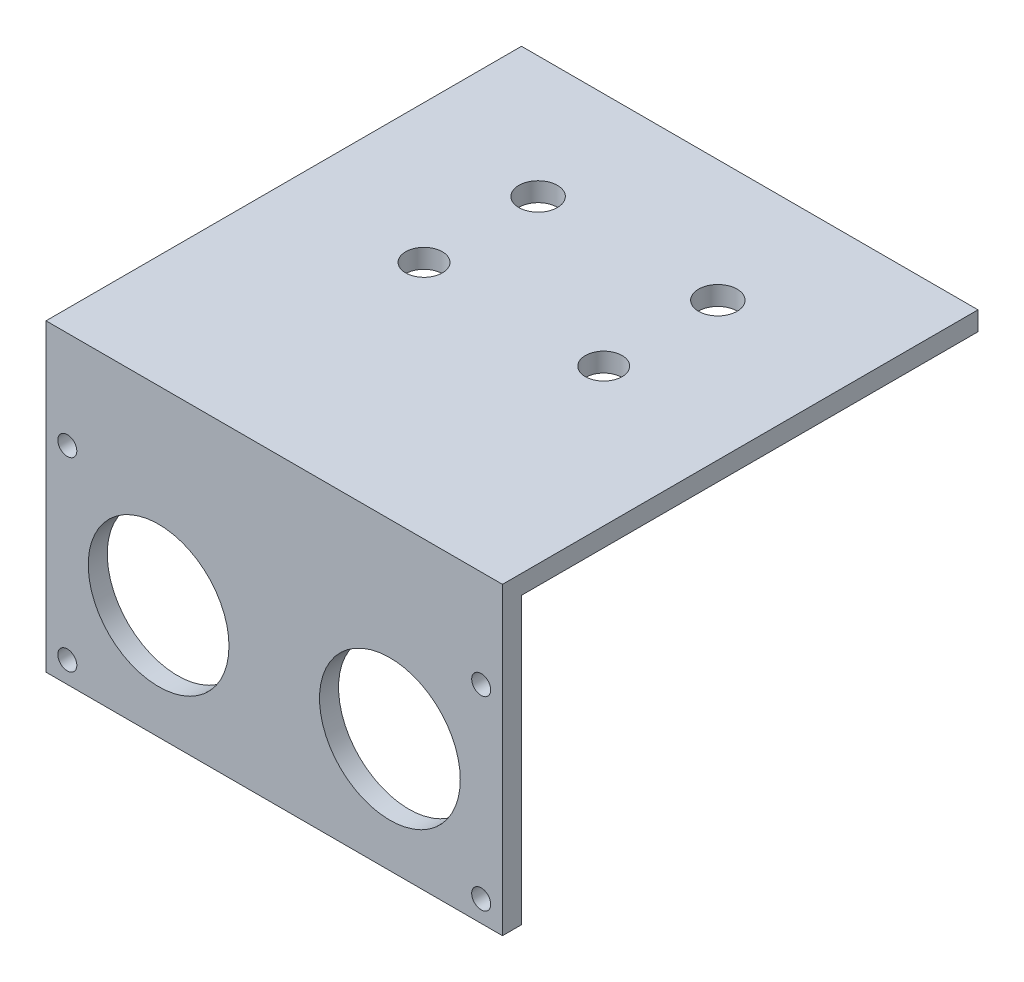
from build123d import *

# Parameters (mm, degrees)
SKETCH1_W           = 152.4
SKETCH1_H           = 101.6
SKETCH1_R           = 3.175
SKETCH1_R_2         = 23.495
BOSS_EXTRUDE2_DEPTH = 6.35
SKETCH2_W           = 152.4
SKETCH2_H           = 6.35
BOSS_EXTRUDE3_DEPTH = 152.4
SKETCH3_R           = 6.129848825
SKETCH3_R_2         = 6.433116146
CUT_EXTRUDE1_DEPTH  = 152.4


with BuildPart() as part:
    # Sketch1 → Boss-Extrude2 (new body)
    with BuildSketch(Plane.XY):
        with Locations((0, 12.7)):
            Rectangle(SKETCH1_W, SKETCH1_H)
        with Locations((-69.088, -30.988)):
            Circle(SKETCH1_R, mode=Mode.SUBTRACT)
        with Locations((-38.608, 0)):
            Circle(SKETCH1_R_2, mode=Mode.SUBTRACT)
        with Locations((69.088, -30.988)):
            Circle(SKETCH1_R, mode=Mode.SUBTRACT)
        with Locations((38.608, 0)):
            Circle(SKETCH1_R_2, mode=Mode.SUBTRACT)
        with Locations((-69.088, 30.988)):
            Circle(SKETCH1_R, mode=Mode.SUBTRACT)
        with Locations((69.088, 30.988)):
            Circle(SKETCH1_R, mode=Mode.SUBTRACT)
    extrude(amount=BOSS_EXTRUDE2_DEPTH)

    # Sketch2 → Boss-Extrude3 (add)
    with BuildSketch(Plane(origin=(0, 0, 0), x_dir=(-1, 0, 0), z_dir=(0, 0, -1))):
        with Locations((0, 60.325)):
            Rectangle(SKETCH2_W, SKETCH2_H)
    extrude(amount=BOSS_EXTRUDE3_DEPTH)

    # Sketch3 → Cut-Extrude1 (cut)
    with BuildSketch(Plane(origin=(0, 63.5, 0), x_dir=(1, 0, 0), z_dir=(0, 1, 0))):
        with Locations((-30, 73.65)):
            Circle(SKETCH3_R)
        with Locations((-30, 111.75)):
            Circle(SKETCH3_R_2)
        with Locations((30, 73.65)):
            Circle(SKETCH3_R)
        with Locations((30, 111.75)):
            Circle(SKETCH3_R_2)
    extrude(amount=-CUT_EXTRUDE1_DEPTH, mode=Mode.SUBTRACT)


solid = part.part
